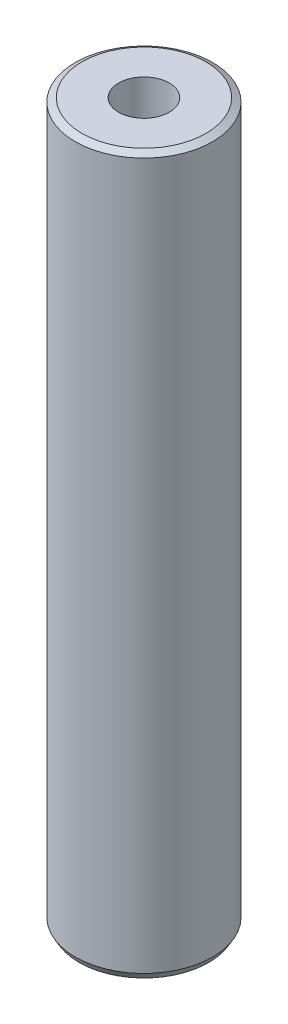
from build123d import *
from OCP.BRepFilletAPI import BRepFilletAPI_MakeChamfer

# Parameters (mm, degrees)
SKETCH1_R           = 57.5
BOSS_EXTRUDE1_DEPTH = 600
SKETCH2_R           = 21.220780514
CUT_EXTRUDE1_DEPTH  = 606.485342515
CHAMFER1_SIZE       = 3.220163496
CHAMFER1_SIZE2      = 5.577486783


with BuildPart() as part:
    # Sketch1 → Boss-Extrude1 (new body)
    with BuildSketch(Plane(origin=(0, 0, 0), x_dir=(1, 0, 0), z_dir=(0, 1, 0))):
        Circle(SKETCH1_R)
    extrude(amount=BOSS_EXTRUDE1_DEPTH)

    # Sketch2 → Cut-Extrude1 (cut, through all)
    with BuildSketch(Plane(origin=(0, 0, 0), x_dir=(1, 0, 0), z_dir=(0, 1, 0))):
        Circle(SKETCH2_R)
    extrude(amount=CUT_EXTRUDE1_DEPTH, mode=Mode.SUBTRACT)

    # Chamfer1: one chamfer whose edges measure the first distance from different faces: ONE call of the kernel's chamfer builder (chamfer() names one face for all edges)
    chamfer1_edges_1 = [part.edges().sort_by_distance(p)[0] for p in [
        (-57.5, 600, 0),
    ]]
    chamfer1_side_1 = [part.faces().sort_by_distance(p)[0] for p in [
        (-57.5, 300, 0),
    ]]
    chamfer1_edges_2 = [part.edges().sort_by_distance(p)[0] for p in [
        (-57.5, 0, 0),
    ]]
    chamfer1_side_2 = [part.faces().sort_by_distance(p)[0] for p in [
        (-55.873654403, 0, 0),
    ]]
    chamfer1 = BRepFilletAPI_MakeChamfer(part.part.solid().wrapped)
    for e in chamfer1_edges_1:
        chamfer1.Add(CHAMFER1_SIZE, CHAMFER1_SIZE2, e.wrapped, chamfer1_side_1[0].wrapped)  # the first distance lies on this face
    for e in chamfer1_edges_2:
        chamfer1.Add(CHAMFER1_SIZE, CHAMFER1_SIZE2, e.wrapped, chamfer1_side_2[0].wrapped)  # the first distance lies on this face
    add(Compound.cast(chamfer1.Shape()), mode=Mode.REPLACE)


solid = part.part
